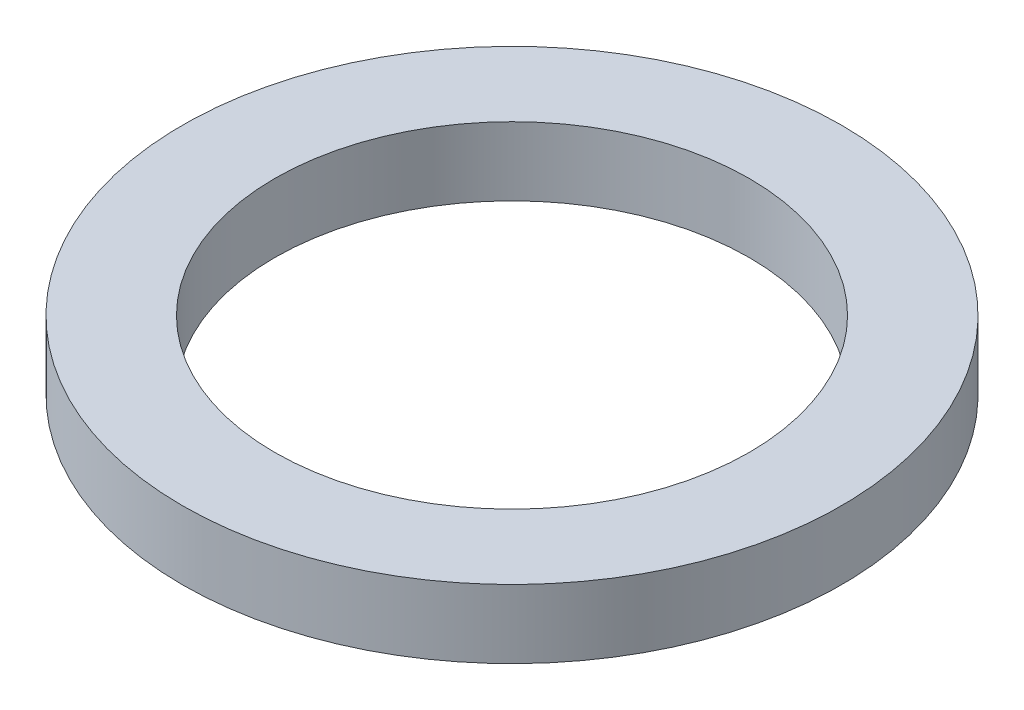
from build123d import *

# Parameters (mm, degrees)
SKETCH1_R           = 62.5
BOSS_EXTRUDE1_DEPTH = 13
SKETCH2_R           = 45
CUT_EXTRUDE1_DEPTH  = 90.339241098


with BuildPart() as part:
    # Sketch1 → Boss-Extrude1 (new body)
    with BuildSketch(Plane(origin=(0, 0, 0), x_dir=(1, 0, 0), z_dir=(0, 1, 0))):
        Circle(SKETCH1_R)
    extrude(amount=BOSS_EXTRUDE1_DEPTH)

    # Sketch2 → Cut-Extrude1 (cut, through all)
    with BuildSketch(Plane(origin=(0, 0, 0), x_dir=(1, 0, 0), z_dir=(0, 1, 0))):
        Circle(SKETCH2_R)
    extrude(amount=CUT_EXTRUDE1_DEPTH, mode=Mode.SUBTRACT)


solid = part.part
